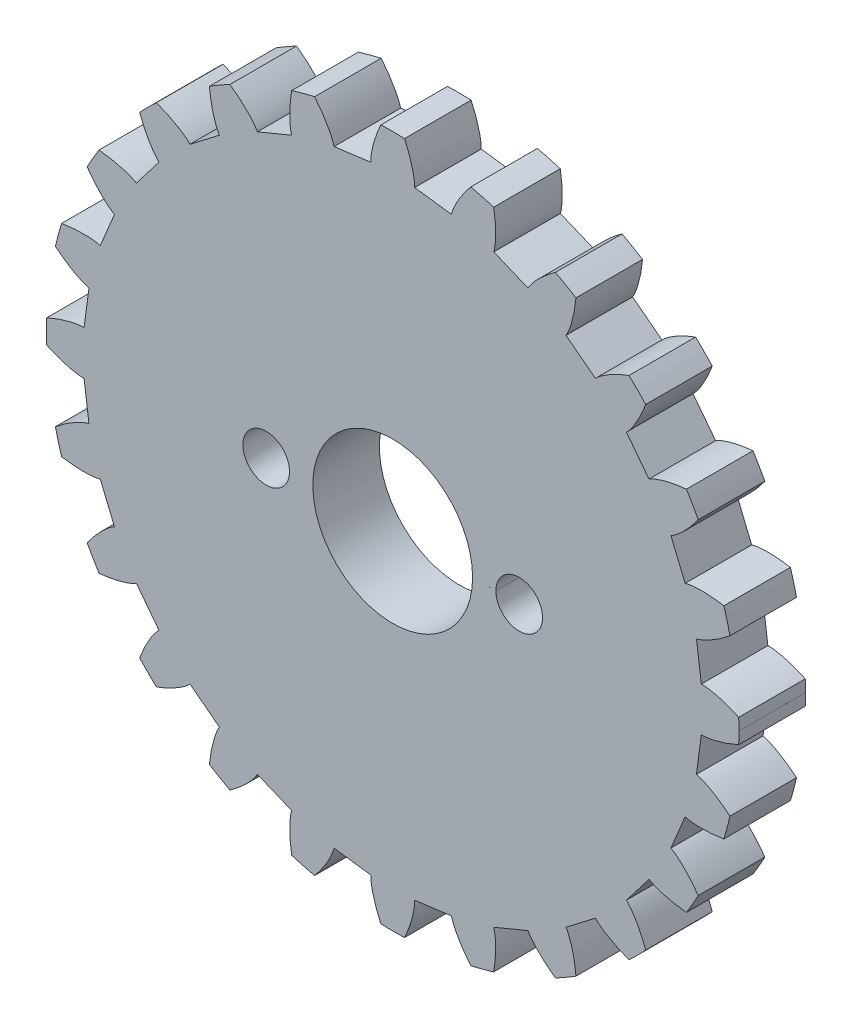
from build123d import *

# Parameters (mm, degrees)
SKETCH1_W               = 26
SKETCH1_H               = 5
REVOLVE1_ANGLE          = 359.999695921
CUT_EXTRUDE2_DEPTH      = 6
CIRPATTERN2_COUNT       = 24
CUT_EXTRUDE4_DEPTH      = 7
CUT_EXTRUDE4_DEPTH_BACK = 7
SKETCH3_R               = 6
SKETCH3_R_2             = 1.75


with BuildPart() as part:
    # Sketch1 → Revolve1 (revolve)
    with BuildSketch(Plane(origin=(0, 0, 0), x_dir=(1, 0, 0), z_dir=(0, 1, 0))):
        with Locations((13, -2.5)):
            Rectangle(SKETCH1_W, SKETCH1_H)
    revolve(axis=Axis((0, 0, 1), (0, 0, 1)), revolution_arc=REVOLVE1_ANGLE)

    # Sketch2 → Cut-Extrude2 (cut, symmetric)
    with BuildSketch(Plane.XY):
        with BuildLine():
            add(Edge.make_bspline(
                [(23.177011452, 1.648214839), (23.181334508, 1.648476152), (23.193469167, 1.649066898), (23.21644737, 1.649622191), (23.253990407, 1.649730291), (23.301893166, 1.648694511), (23.363877463, 1.646007435), (23.436976629, 1.641106961), (23.517385457, 1.633902808), (23.604936789, 1.624101126), (23.692334914, 1.612585168), (23.779559647, 1.599479511), (23.866480028, 1.584964537), (23.97179544, 1.565656387), (24.098109724, 1.540104733), (24.245772691, 1.506741047), (24.413250584, 1.464772789), (24.583915466, 1.417582652), (24.751819259, 1.367517322), (24.921399292, 1.312757179), (25.085429511, 1.256815406), (25.255708411, 1.19442981), (25.412835504, 1.134668966), (25.588734702, 1.062978326), (25.730647904, 1.003740753), (25.877106617, 0.938597761), (25.948367996, 0.906309242), (25.984777755, 0.889562166)],
                knots=[4.9e-08, 4.9e-08, 4.9e-08, 4.9e-08, 4.9e-08, 0.005376749, 0.015083688, 0.02853182, 0.04661014, 0.064854849, 0.092110526, 0.119476176, 0.146842496, 0.174208854, 0.201574956, 0.228941013, 0.256307345, 0.307035032, 0.361767352, 0.416499661, 0.471231937, 0.525964282, 0.580696616, 0.635428982, 0.690161387, 0.744893688, 0.799626082, 0.854358407, 0.909090945, 0.909090945, 0.909090945, 0.909090945, 0.909090945], degree=4))
            add(Edge.make_bspline(
                [(25.984777755, 0.889562166), (26.326337644, 0.901255077), (27.022297624, 0.925080551), (28.753438041, 0.984344362), (30.156496922, 1.032376639), (32.175730812, 1.101503033), (33.880296874, 1.159857098), (35.848494254, 1.22723631), (37.694657729, 1.290437817), (39.650617192, 1.357398076), (41.531074843, 1.421773609), (43.432052562, 1.486851625), (45.27081659, 1.549799819), (47.012870983, 1.609437258), (48.716308198, 1.667752678), (50.22847828, 1.719520265), (51.638447234, 1.767789101), (52.961301877, 1.813075668), (54.260530168, 1.857553412), (55.450552976, 1.898292618), (56.867671345, 1.946806207), (57.895610662, 1.981996652), (59.165556981, 2.025471957), (59.698554144, 2.043718567), (59.964752001, 2.052831576)],
                knots=[0.083333333, 0.083333333, 0.083333333, 0.083333333, 0.083333333, 0.123540522, 0.166752518, 0.20939217, 0.256181319, 0.300394918, 0.346611722, 0.394831731, 0.442050137, 0.489268544, 0.532909799, 0.580271291, 0.622910943, 0.660113324, 0.699652778, 0.729462378, 0.759701236, 0.792420253, 0.822587569, 0.854042659, 0.885330815, 0.916666667, 0.916666667, 0.916666667, 0.916666667, 0.916666667], degree=4))
            add(Edge.make_bspline(
                [(59.964752001, 2.052831576), (59.960814186, 2.167858114), (59.952297358, 2.391864205), (59.929164639, 2.956118344), (59.904214054, 3.387496151), (59.867605218, 4.011105795), (59.829864935, 4.51860188), (59.784692875, 5.095593464), (59.735840758, 5.630008668), (59.681149933, 6.189197163), (59.621758447, 6.733032502), (59.557276862, 7.284499224), (59.487467195, 7.831673622), (59.413279, 8.378271577), (59.332833338, 8.927636588), (59.249446165, 9.468312835), (59.157544813, 10.022602471), (59.066415503, 10.551451777), (58.960711951, 11.120474239), (58.865816613, 11.620445718), (58.739775981, 12.232281443), (58.652227604, 12.655418094), (58.528532377, 13.206432928), (58.478781958, 13.425010514), (58.452814537, 13.537136799)],
                knots=[0.083333333, 0.083333333, 0.083333333, 0.083333333, 0.083333333, 0.123015873, 0.162698413, 0.202380952, 0.242063492, 0.281746032, 0.321428571, 0.361111111, 0.400793651, 0.44047619, 0.48015873, 0.51984127, 0.55952381, 0.599206349, 0.638888889, 0.678571429, 0.718253968, 0.757936508, 0.797619048, 0.837301587, 0.876984127, 0.916666667, 0.916666667, 0.916666667, 0.916666667, 0.916666667], degree=4))
            add(Edge.make_bspline(
                [(58.452814537, 13.537136799), (58.20964739, 13.480821513), (57.763573408, 13.377514862), (56.725391472, 13.137081428), (55.8234494, 12.9281999), (54.568002695, 12.637449934), (53.442908126, 12.37688833), (52.051066759, 12.054550609), (50.599185378, 11.71830817), (49.050388981, 11.359621101), (47.456325392, 10.990450564), (45.863179114, 10.621492469), (44.310239505, 10.261845869), (42.761818753, 9.903245796), (41.19068425, 9.539385426), (39.606325736, 9.172462496), (38.04283385, 8.810372086), (36.384968272, 8.426425592), (34.823246198, 8.064745055), (33.059291031, 7.656229184), (31.526671947, 7.301288632), (29.630406056, 6.862130808), (28.296636624, 6.553242016), (26.46186913, 6.128326658), (25.742799277, 5.961796662), (25.329603628, 5.866104331)],
                knots=[0.083333333, 0.083333333, 0.083333333, 0.083333333, 0.083333333, 0.112698499, 0.136843192, 0.163042686, 0.191354652, 0.22865676, 0.25743007, 0.29840472, 0.340289918, 0.382675918, 0.419052302, 0.457932692, 0.497207653, 0.537818085, 0.578079473, 0.616034139, 0.656644571, 0.701140006, 0.741113054, 0.783999854, 0.826385854, 0.866768648, 0.916666667, 0.916666667, 0.916666667, 0.916666667, 0.916666667], degree=4))
            add(Edge.make_bspline(
                [(22.813863401, 4.406598729), (22.818106786, 4.407465209), (22.829980863, 4.410035274), (22.852319823, 4.415446098), (22.88861159, 4.425058535), (22.934614023, 4.438457167), (22.993790789, 4.457095399), (23.063130826, 4.48074835), (23.138935217, 4.508518364), (23.220966449, 4.540646014), (23.302406005, 4.574389875), (23.383266634, 4.60962439), (23.463468523, 4.646141428), (23.560198082, 4.692049302), (23.675595057, 4.749422847), (23.809591373, 4.819867681), (23.960500411, 4.903752374), (24.113136321, 4.993505868), (24.26236107, 5.085321962), (24.411989837, 5.182106741), (24.555952065, 5.278596488), (24.704282272, 5.382927769), (24.840588144, 5.481319796), (24.991938819, 5.596093699), (25.113684634, 5.690042641), (25.238292641, 5.790872243), (25.298768964, 5.840504359), (25.329603628, 5.866104331)],
                knots=[0, 0, 0, 0, 0, 0.005376749, 0.015083688, 0.02853182, 0.04661014, 0.064854849, 0.092110526, 0.119476176, 0.146842496, 0.174208854, 0.201574956, 0.228941013, 0.256307345, 0.307035032, 0.361767352, 0.416499661, 0.471231937, 0.525964282, 0.580696616, 0.635428982, 0.690161387, 0.744893688, 0.799626082, 0.854358407, 0.909090914, 0.909090914, 0.909090914, 0.909090914, 0.909090914], degree=4))
            add(Edge.make_bspline(
                [(22.813863401, 4.406598729), (22.817584815, 4.378331786), (22.824435682, 4.326294289), (22.843127325, 4.184317157), (22.856700715, 4.081217025), (22.877221208, 3.925348406), (22.893988729, 3.79798644), (22.912784591, 3.655217697), (22.929847095, 3.525615107), (22.94758374, 3.390891914), (22.963787833, 3.267809614), (22.980920206, 3.137676314), (22.998141151, 3.006870255), (23.01614685, 2.870103392), (23.034495263, 2.730733359), (23.053237156, 2.588374548), (23.071092368, 2.452750745), (23.090657146, 2.3041415), (23.107541818, 2.175889682), (23.129513893, 2.008995205), (23.144430986, 1.895688635), (23.164837088, 1.740688902), (23.172880923, 1.679589913), (23.177011452, 1.648214839)],
                knots=[0.083333333, 0.083333333, 0.083333333, 0.083333333, 0.083333333, 0.124323918, 0.163161058, 0.206805889, 0.246995192, 0.28891226, 0.331780849, 0.370108841, 0.409254808, 0.448242187, 0.482805823, 0.525716146, 0.568843483, 0.611703726, 0.653695913, 0.694185697, 0.738247863, 0.782176482, 0.823818109, 0.87116887, 0.916666667, 0.916666667, 0.916666667, 0.916666667, 0.916666667], degree=4))
        make_face()
    cut_extrude2 = extrude(amount=CUT_EXTRUDE2_DEPTH, both=True, mode=Mode.SUBTRACT)

    # CirPattern2: Cut-Extrude2 ×24 about axis
    cirpattern2_axis = Axis((0, 0, 5), (0, 0, -1))
    for i in range(1, CIRPATTERN2_COUNT):
        add(cut_extrude2.rotate(cirpattern2_axis, i * 360 / CIRPATTERN2_COUNT), mode=Mode.SUBTRACT)

    # Sketch3 → Cut-Extrude4 (cut, two sides: drawn at the far end of the back side and taken through both)
    with BuildSketch(Plane.XY.offset(-CUT_EXTRUDE4_DEPTH_BACK)):
        Circle(SKETCH3_R)
        with Locations((9.5, -5.0418e-05)):
            Circle(SKETCH3_R_2)
        with Locations((-9.5, 0)):
            Circle(SKETCH3_R_2)
    extrude(amount=CUT_EXTRUDE4_DEPTH + CUT_EXTRUDE4_DEPTH_BACK, mode=Mode.SUBTRACT)


solid = part.part
